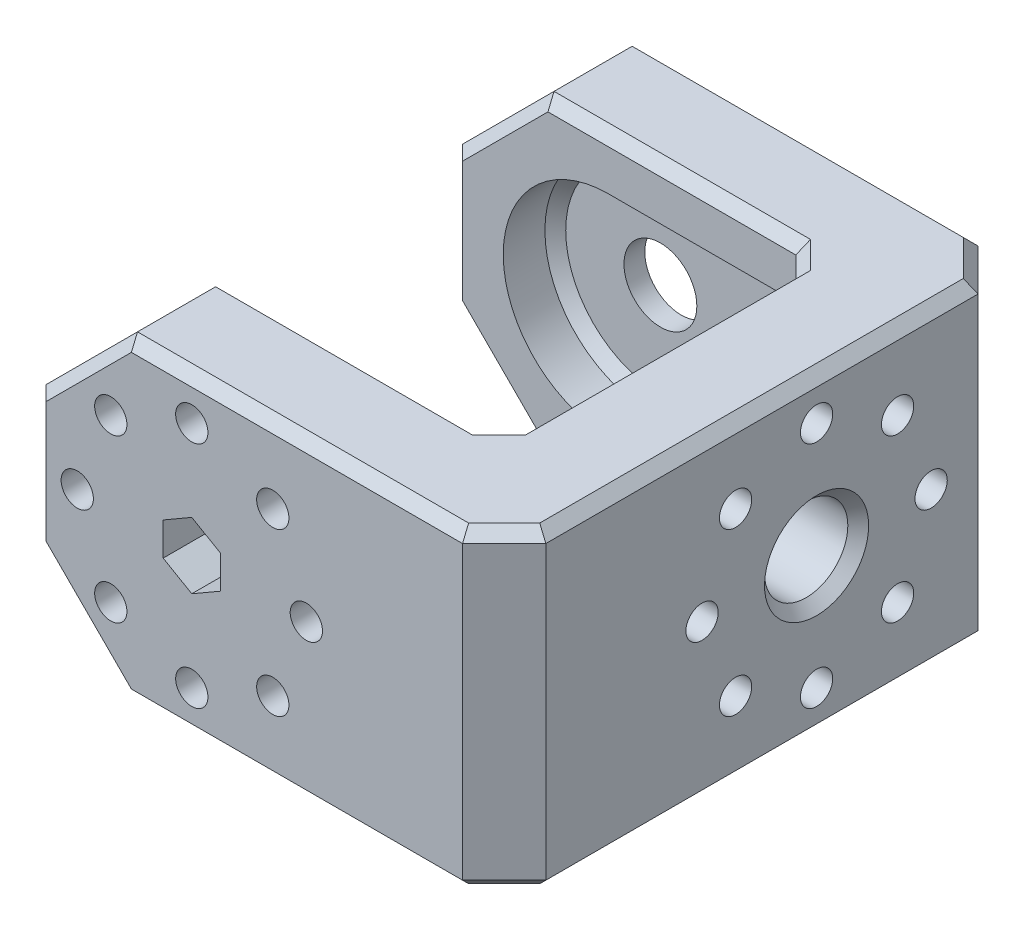
from build123d import *

# Parameters (mm, degrees)
SALIENTE_EXTRUIR1_DEPTH = 60
CROQUIS2_W              = 35
CROQUIS2_H              = 30.5
CROQUIS2_H_2            = 10.5
CORTAR_EXTRUIR1_DEPTH   = 74.484692283
CORTAR_EXTRUIR2_REACH   = 70.739
CROQUIS3_R              = 1.5
CORTAR_EXTRUIR3_DEPTH   = 5
CROQUIS5_R              = 4
CROQUIS5_R_2            = 1.55
CORTAR_EXTRUIR4_DEPTH   = 10
CORTAR_EXTRUIR5_DEPTH   = 5
CORTAR_EXTRUIR6_REACH   = 70.739
CROQUIS7_R              = 1.55
CORTAR_EXTRUIR7_DEPTH   = 5
CORTAR_EXTRUIR8_DEPTH   = 5
CORTAR_EXTRUIR9_REACH   = 61.793
CROQUIS10_R             = 3.5
CROQUIS11_R             = 8.22128135
CORTAR_EXTRUIR10_DEPTH  = 2.5
CROQUIS12_W             = 2.4
CROQUIS12_H             = 1.2
CORTAR_EXTRUIR11_DEPTH  = 3
CROQUIS13_W             = 10
CROQUIS13_H             = 10.5
CORTAR_EXTRUIR12_DEPTH  = 74.484692283
CHAFL_N5_SIZE           = 1
CHAFL_N4_SIZE           = 0.25
CHAFL_N1_SIZE           = 2
CHAFL_N2_SIZE           = 2
CHAFL_N6_SIZE           = 4
CHAFL_N7_SIZE           = 1
CHAFL_N3_SIZE           = 1


with BuildPart() as part:
    # Croquis1 → Saliente-Extruir1 (new body)
    with BuildSketch(Plane.XY):
        Polygon((6.213203436, 15), (30, 15), (30, -15), (6.213203436, -15), (-6.213203436, -15), (-15, -6.213203436), (-15, 6.213203436), (-6.213203436, 15), align=None)
    extrude(amount=SALIENTE_EXTRUIR1_DEPTH)

    # Croquis2 → Cortar-Extruir1 (cut, through all)
    with BuildSketch(Plane(origin=(0, 15, 0), x_dir=(1, 0, 0), z_dir=(0, 1, 0))):
        with Locations((2.5, -35.25)):
            Rectangle(CROQUIS2_W, CROQUIS2_H)
        with Locations((2.5, -5.25)):
            Rectangle(CROQUIS2_W, CROQUIS2_H_2)
    extrude(amount=-CORTAR_EXTRUIR1_DEPTH, mode=Mode.SUBTRACT)

    # Croquis3 → Cortar-Extruir2 (cut, up to next)
    with BuildSketch(Plane.XY.offset(60), mode=Mode.PRIVATE) as cortar_extruir2_sk1:
        Circle(CROQUIS3_R)
    cortar_extruir2_tool1 = extrude(cortar_extruir2_sk1.sketch, amount=-CORTAR_EXTRUIR2_REACH, mode=Mode.PRIVATE) & part.part
    add(cortar_extruir2_tool1.solids().sort_by_distance((0, 0, 60))[0], mode=Mode.SUBTRACT)

    # Croquis4 → Cortar-Extruir3 (cut)
    with BuildSketch(Plane.XY.offset(20)):
        with BuildLine():
            Line((0, 10.090227798), (20, 10.090227798))
            Line((20, 10.090227798), (20, -10.090227798))
            Line((20, -10.090227798), (0, -10.090227798))
            ThreePointArc((0, -10.090227798), (-10.090227798, 0), (0, 10.090227798))
        make_face()
    extrude(amount=-CORTAR_EXTRUIR3_DEPTH, mode=Mode.SUBTRACT)

    # Croquis5 → Cortar-Extruir4 (cut)
    with BuildSketch(Plane(origin=(30, 0, 0), x_dir=(0, 0, -1), z_dir=(1, 0, 0))):
        with Locations(Location((-30, 0, 0), (0, 0, 90))):
            Circle(CROQUIS5_R)
        with Locations(Location((-30, 11, 0), (0, 0, 90))):
            Circle(CROQUIS5_R_2)
        with Locations(Location((-22.221825407, 7.778174593, 0), (0, 0, 90))):
            Circle(CROQUIS5_R_2)
        with Locations(Location((-19, 0, 0), (0, 0, 90))):
            Circle(CROQUIS5_R_2)
        with Locations(Location((-22.221825407, -7.778174593, 0), (0, 0, 90))):
            Circle(CROQUIS5_R_2)
        with Locations(Location((-30, -11, 0), (0, 0, 90))):
            Circle(CROQUIS5_R_2)
        with Locations(Location((-37.778174593, -7.778174593, 0), (0, 0, 90))):
            Circle(CROQUIS5_R_2)
        with Locations(Location((-41, 0, 0), (0, 0, 90))):
            Circle(CROQUIS5_R_2)
        with Locations(Location((-37.778174593, 7.778174593, 0), (0, 0, 90))):
            Circle(CROQUIS5_R_2)
    extrude(amount=-CORTAR_EXTRUIR4_DEPTH, mode=Mode.SUBTRACT)

    # Croquis6 → Cortar-Extruir5 (cut)
    with BuildSketch(Plane.ZY.offset(-20)):
        Polygon((40.023540191, 5.532808996), (40.84540104, 8.600035443), (38.600035443, 10.84540104), (35.532808996, 10.023540191), (34.710948146, 6.956313744), (36.956313744, 4.710948146), align=None)
        Polygon((33.175426481, 11), (31.58771324, 13.75), (28.41228676, 13.75), (26.824573519, 11), (28.41228676, 8.25), (31.58771324, 8.25), align=None)
        Polygon((41, -3.175426481), (43.75, -1.58771324), (43.75, 1.58771324), (41, 3.175426481), (38.25, 1.58771324), (38.25, -1.58771324), align=None)
        Polygon((35.532808996, -10.023540191), (38.600035443, -10.84540104), (40.84540104, -8.600035443), (40.023540191, -5.532808996), (36.956313744, -4.710948146), (34.710948146, -6.956313744), align=None)
        Polygon((26.824573519, -11), (28.41228676, -13.75), (31.58771324, -13.75), (33.175426481, -11), (31.58771324, -8.25), (28.41228676, -8.25), align=None)
        Polygon((19.976459809, -5.532808996), (19.15459896, -8.600035443), (21.399964557, -10.84540104), (24.467191005, -10.023540191), (25.289051854, -6.956313744), (23.043686256, -4.710948146), align=None)
        Polygon((19, 3.175426481), (16.25, 1.58771324), (16.25, -1.58771324), (19, -3.175426481), (21.75, -1.58771324), (21.75, 1.58771324), align=None)
        Polygon((24.467191004, 10.023540191), (21.399964557, 10.84540104), (19.15459896, 8.600035443), (19.976459809, 5.532808996), (23.043686256, 4.710948146), (25.289051854, 6.956313744), align=None)
    extrude(amount=-CORTAR_EXTRUIR5_DEPTH, mode=Mode.SUBTRACT)

    # Croquis7 → Cortar-Extruir6 (cut, up to next)
    with BuildSketch(Plane.XY.offset(60), mode=Mode.PRIVATE) as cortar_extruir6_sk1:
        with Locations((0, 11)):
            Circle(CROQUIS7_R)
    cortar_extruir6_tool1 = extrude(cortar_extruir6_sk1.sketch, amount=-CORTAR_EXTRUIR6_REACH, mode=Mode.PRIVATE) & part.part
    # Croquis7 → Cortar-Extruir6 (cut, up to next)
    with BuildSketch(Plane.XY.offset(60), mode=Mode.PRIVATE) as cortar_extruir6_sk2:
        with Locations((7.778174593, 7.778174593)):
            Circle(CROQUIS7_R)
    cortar_extruir6_tool2 = extrude(cortar_extruir6_sk2.sketch, amount=-CORTAR_EXTRUIR6_REACH, mode=Mode.PRIVATE) & part.part
    # Croquis7 → Cortar-Extruir6 (cut, up to next)
    with BuildSketch(Plane.XY.offset(60), mode=Mode.PRIVATE) as cortar_extruir6_sk3:
        with Locations((11, 0)):
            Circle(CROQUIS7_R)
    cortar_extruir6_tool3 = extrude(cortar_extruir6_sk3.sketch, amount=-CORTAR_EXTRUIR6_REACH, mode=Mode.PRIVATE) & part.part
    # Croquis7 → Cortar-Extruir6 (cut, up to next)
    with BuildSketch(Plane.XY.offset(60), mode=Mode.PRIVATE) as cortar_extruir6_sk4:
        with Locations((7.778174593, -7.778174593)):
            Circle(CROQUIS7_R)
    cortar_extruir6_tool4 = extrude(cortar_extruir6_sk4.sketch, amount=-CORTAR_EXTRUIR6_REACH, mode=Mode.PRIVATE) & part.part
    # Croquis7 → Cortar-Extruir6 (cut, up to next)
    with BuildSketch(Plane.XY.offset(60), mode=Mode.PRIVATE) as cortar_extruir6_sk5:
        with Locations((0, -11)):
            Circle(CROQUIS7_R)
    cortar_extruir6_tool5 = extrude(cortar_extruir6_sk5.sketch, amount=-CORTAR_EXTRUIR6_REACH, mode=Mode.PRIVATE) & part.part
    # Croquis7 → Cortar-Extruir6 (cut, up to next)
    with BuildSketch(Plane.XY.offset(60), mode=Mode.PRIVATE) as cortar_extruir6_sk6:
        with Locations((-7.778174593, -7.778174593)):
            Circle(CROQUIS7_R)
    cortar_extruir6_tool6 = extrude(cortar_extruir6_sk6.sketch, amount=-CORTAR_EXTRUIR6_REACH, mode=Mode.PRIVATE) & part.part
    # Croquis7 → Cortar-Extruir6 (cut, up to next)
    with BuildSketch(Plane.XY.offset(60), mode=Mode.PRIVATE) as cortar_extruir6_sk7:
        with Locations((-11, 0)):
            Circle(CROQUIS7_R)
    cortar_extruir6_tool7 = extrude(cortar_extruir6_sk7.sketch, amount=-CORTAR_EXTRUIR6_REACH, mode=Mode.PRIVATE) & part.part
    # Croquis7 → Cortar-Extruir6 (cut, up to next)
    with BuildSketch(Plane.XY.offset(60), mode=Mode.PRIVATE) as cortar_extruir6_sk8:
        with Locations((-7.778174593, 7.778174593)):
            Circle(CROQUIS7_R)
    cortar_extruir6_tool8 = extrude(cortar_extruir6_sk8.sketch, amount=-CORTAR_EXTRUIR6_REACH, mode=Mode.PRIVATE) & part.part
    add(cortar_extruir6_tool1.solids().sort_by_distance((0, 11, 60))[0], mode=Mode.SUBTRACT)
    add(cortar_extruir6_tool2.solids().sort_by_distance((7.778175, 7.778175, 60))[0], mode=Mode.SUBTRACT)
    add(cortar_extruir6_tool3.solids().sort_by_distance((11, 0, 60))[0], mode=Mode.SUBTRACT)
    add(cortar_extruir6_tool4.solids().sort_by_distance((7.778175, -7.778175, 60))[0], mode=Mode.SUBTRACT)
    add(cortar_extruir6_tool5.solids().sort_by_distance((0, -11, 60))[0], mode=Mode.SUBTRACT)
    add(cortar_extruir6_tool6.solids().sort_by_distance((-7.778175, -7.778175, 60))[0], mode=Mode.SUBTRACT)
    add(cortar_extruir6_tool7.solids().sort_by_distance((-11, 0, 60))[0], mode=Mode.SUBTRACT)
    add(cortar_extruir6_tool8.solids().sort_by_distance((-7.778175, 7.778175, 60))[0], mode=Mode.SUBTRACT)

    # Croquis8 → Cortar-Extruir7 (cut)
    with BuildSketch(Plane(origin=(0, 0, 50.5), x_dir=(-1, 0, 0), z_dir=(0, 0, -1))):
        Polygon((6.956313744, 4.710948146), (10.023540191, 5.532808996), (10.84540104, 8.600035443), (8.600035443, 10.84540104), (5.532808996, 10.023540191), (4.710948146, 6.956313744), align=None)
        Polygon((3.175426481, 11), (1.58771324, 13.75), (-1.58771324, 13.75), (-3.175426481, 11), (-1.58771324, 8.25), (1.58771324, 8.25), align=None)
        Polygon((8.25, -1.58771324), (11, -3.175426481), (13.75, -1.58771324), (13.75, 1.58771324), (11, 3.175426481), (8.25, 1.58771324), align=None)
        Polygon((4.710948146, -6.956313744), (5.532808996, -10.023540191), (8.600035443, -10.84540104), (10.84540104, -8.600035443), (10.023540191, -5.532808995), (6.956313744, -4.710948146), align=None)
        Polygon((-1.58771324, -8.25), (-3.175426481, -11), (-1.58771324, -13.75), (1.58771324, -13.75), (3.175426481, -11), (1.58771324, -8.25), align=None)
        Polygon((-6.956313744, -4.710948146), (-10.023540191, -5.532808996), (-10.84540104, -8.600035443), (-8.600035443, -10.84540104), (-5.532808995, -10.023540191), (-4.710948146, -6.956313744), align=None)
        Polygon((-8.25, 1.58771324), (-11, 3.175426481), (-13.75, 1.58771324), (-13.75, -1.58771324), (-11, -3.175426481), (-8.25, -1.58771324), align=None)
        Polygon((-4.710948146, 6.956313744), (-5.532808996, 10.023540191), (-8.600035443, 10.84540104), (-10.84540104, 8.600035443), (-10.023540191, 5.532808995), (-6.956313744, 4.710948146), align=None)
    extrude(amount=-CORTAR_EXTRUIR7_DEPTH, mode=Mode.SUBTRACT)

    # Croquis9 → Cortar-Extruir8 (cut)
    with BuildSketch(Plane.XY.offset(60)):
        Polygon((0, 3.175426481), (-2.75, 1.58771324), (-2.75, -1.58771324), (0, -3.175426481), (2.75, -1.58771324), (2.75, 1.58771324), align=None)
    extrude(amount=-CORTAR_EXTRUIR8_DEPTH, mode=Mode.SUBTRACT)

    # Croquis10 → Cortar-Extruir9 (cut, up to next)
    with BuildSketch(Plane(origin=(0, 0, 10.5), x_dir=(-1, 0, 0), z_dir=(0, 0, -1)), mode=Mode.PRIVATE) as cortar_extruir9_sk1:
        Circle(CROQUIS10_R)
    cortar_extruir9_tool1 = extrude(cortar_extruir9_sk1.sketch, amount=-CORTAR_EXTRUIR9_REACH, mode=Mode.PRIVATE) & part.part
    add(cortar_extruir9_tool1.solids().sort_by_distance((0, 0, 10.5))[0], mode=Mode.SUBTRACT)

    # Croquis11 → Cortar-Extruir10 (cut)
    with BuildSketch(Plane(origin=(0, 0, 10.5), x_dir=(-1, 0, 0), z_dir=(0, 0, -1))):
        Circle(CROQUIS11_R)
    extrude(amount=-CORTAR_EXTRUIR10_DEPTH, mode=Mode.SUBTRACT)

    # Croquis12 → Cortar-Extruir11 (cut)
    with BuildSketch(Plane.XY.offset(15)):
        with Locations((0, 8)):
            Rectangle(CROQUIS12_W, CROQUIS12_H)
    extrude(amount=-CORTAR_EXTRUIR11_DEPTH, mode=Mode.SUBTRACT)

    # Croquis13 → Cortar-Extruir12 (cut, through all)
    with BuildSketch(Plane.XZ.offset(15)):
        with Locations((25, 5.25)):
            Rectangle(CROQUIS13_W, CROQUIS13_H)
    extrude(amount=-CORTAR_EXTRUIR12_DEPTH, mode=Mode.SUBTRACT)

    # Chaflán5
    chafl_n5_edges = [part.edges().sort_by_distance(p)[0] for p in [
        (20, -4, 30),
        (30, -4, 30),
    ]]
    chamfer(chafl_n5_edges, length=CHAFL_N5_SIZE)

    # Chaflán4
    chafl_n4_edges = [part.edges().sort_by_distance(p)[0] for p in [
        (1.2, 8, 15),
        (0, 8.6, 15),
        (-1.2, 8, 15),
        (0, 7.4, 15),
    ]]
    chamfer(chafl_n4_edges, length=CHAFL_N4_SIZE)

    # Chaflán1
    # the kernel refuses this chamfer: 2 mm, written as the material it adds along each edge
    with BuildSketch(Plane(origin=(20, 15, 50.5), x_dir=(0.027495876610585647, 0, -0.9996219169112968), z_dir=(0, -1, 0))) as chafl_n1_piece_1:
        Polygon((CHAFL_N1_SIZE * 0.999621916911, -CHAFL_N1_SIZE * 0.0274958766106), (-CHAFL_N1_SIZE * 0.0274958766106, -CHAFL_N1_SIZE * 0.999621916911), (0, 0), align=None)
    extrude(amount=30)
    with BuildSketch(Plane(origin=(20, -10.090227798, 20), x_dir=(0.027495876610585696, 0, 0.9996219169112968), z_dir=(0, -1, 0))) as chafl_n1_piece_2_section:
        Polygon((CHAFL_N1_SIZE * 0.999621916911, CHAFL_N1_SIZE * 0.0274958766106), (-CHAFL_N1_SIZE * 0.0274958766106, CHAFL_N1_SIZE * 0.999621916911), (0, 0), align=None)
    chafl_n1_piece_2 = extrude(amount=4.909772202, mode=Mode.PRIVATE)
    chafl_n1_piece_2 = split(chafl_n1_piece_2, bisect_by=Plane(origin=(19.221242509, -10.256505809, 20.811069327), z_dir=(0, -0.7071067811865422, -0.7071067811865529)), keep=Keep.TOP, mode=Mode.PRIVATE)
    add(chafl_n1_piece_2)
    with BuildSketch(Plane(origin=(20, -4.946861822, 20), x_dir=(0.027495876610585696, 0, 0.9996219169112968), z_dir=(0, -1, 0))) as chafl_n1_piece_3_section:
        Polygon((CHAFL_N1_SIZE * 0.999621916911, CHAFL_N1_SIZE * 0.0274958766106), (-CHAFL_N1_SIZE * 0.0274958766106, CHAFL_N1_SIZE * 0.999621916911), (0, 0), align=None)
    chafl_n1_piece_3 = extrude(amount=15.196504154, mode=Mode.PRIVATE)
    chafl_n1_piece_3 = split(chafl_n1_piece_3, bisect_by=Plane(origin=(19.849991139, -10.77775276, 21.652431375), z_dir=(0, -0.9659258262890706, 0.2588190451025121)), keep=Keep.TOP, mode=Mode.PRIVATE)
    chafl_n1_piece_3 = split(chafl_n1_piece_3, bisect_by=Plane(origin=(19.849991139, -11.050316955, 21.604880472), z_dir=(0, 0.7071067811865422, 0.7071067811865529)), keep=Keep.TOP, mode=Mode.PRIVATE)
    add(chafl_n1_piece_3)
    with BuildSketch(Plane(origin=(20, 15, 20), x_dir=(0.027495876610585696, 0, 0.9996219169112968), z_dir=(0, -1, 0))) as chafl_n1_piece_4_section:
        Polygon((CHAFL_N1_SIZE * 0.999621916911, CHAFL_N1_SIZE * 0.0274958766106), (-CHAFL_N1_SIZE * 0.0274958766106, CHAFL_N1_SIZE * 0.999621916911), (0, 0), align=None)
    chafl_n1_piece_4 = extrude(amount=10.053138178, mode=Mode.PRIVATE)
    chafl_n1_piece_4 = split(chafl_n1_piece_4, bisect_by=Plane(origin=(19.337901825, 11.172841883, 20.177938697), z_dir=(0, 0.9659258262890684, 0.2588190451025204)), keep=Keep.TOP, mode=Mode.PRIVATE)
    add(chafl_n1_piece_4)
    with BuildSketch(Plane(origin=(20, 20.143365976, 20), x_dir=(0.027495876610585696, 0, 0.9996219169112968), z_dir=(0, -1, 0))) as chafl_n1_piece_5_section:
        Polygon((CHAFL_N1_SIZE * 0.999621916911, CHAFL_N1_SIZE * 0.0274958766106), (-CHAFL_N1_SIZE * 0.0274958766106, CHAFL_N1_SIZE * 0.999621916911), (0, 0), align=None)
    chafl_n1_piece_5 = extrude(amount=10.053138178, mode=Mode.PRIVATE)
    chafl_n1_piece_5 = split(chafl_n1_piece_5, bisect_by=Plane(origin=(19.221242509, 10.256505809, 20.811069327), z_dir=(0, 0.7071067811865478, -0.7071067811865472)), keep=Keep.TOP, mode=Mode.PRIVATE)
    chafl_n1_piece_5 = split(chafl_n1_piece_5, bisect_by=Plane(origin=(19.221242509, 11.070012891, 20.561701717), z_dir=(0, -0.9659258262890684, -0.2588190451025204)), keep=Keep.TOP, mode=Mode.PRIVATE)
    add(chafl_n1_piece_5)

    # Chaflán2
    # the kernel refuses this chamfer: 2 mm, written as the material it adds along each edge
    with BuildSketch(Plane(origin=(20, 15.233593774, 15), x_dir=(-0.9996219169112968, 0, -0.02749587661058651), z_dir=(0, -1, 0))) as chafl_n2_piece_1_section:
        Polygon((CHAFL_N2_SIZE * 0.999621916911, -CHAFL_N2_SIZE * 0.0274958766106), (-CHAFL_N2_SIZE * 0.0274958766106, -CHAFL_N2_SIZE * 0.999621916911), (0, 0), align=None)
    chafl_n2_piece_1 = extrude(amount=25.323821571, mode=Mode.PRIVATE)
    chafl_n2_piece_1 = split(chafl_n2_piece_1, bisect_by=Plane(origin=(19.261226971, 5.628946063, 16.25), z_dir=(0, 0, -1)), keep=Keep.TOP, mode=Mode.PRIVATE)
    chafl_n2_piece_1 = split(chafl_n2_piece_1, bisect_by=Plane(origin=(19.261226971, 15, 15.522453942), z_dir=(0, -1, 0)), keep=Keep.TOP, mode=Mode.PRIVATE)
    add(chafl_n2_piece_1)
    with BuildSketch(Plane(origin=(20, 15.233593774, 15), x_dir=(-0.9996219169112968, 0, -0.02749587661058651), z_dir=(0, -1, 0))) as chafl_n2_piece_2_section:
        Polygon((CHAFL_N2_SIZE * 0.999621916911, -CHAFL_N2_SIZE * 0.0274958766106), (-CHAFL_N2_SIZE * 0.0274958766106, -CHAFL_N2_SIZE * 0.999621916911), (0, 0), align=None)
    chafl_n2_piece_2 = extrude(amount=30.467187547, mode=Mode.PRIVATE)
    chafl_n2_piece_2 = split(chafl_n2_piece_2, bisect_by=Plane(origin=(19.748920686, 2.775732432, 18.307709601), z_dir=(0, 0.8660254037844436, -0.4999999999999916)), keep=Keep.TOP, mode=Mode.PRIVATE)
    chafl_n2_piece_2 = split(chafl_n2_piece_2, bisect_by=Plane(origin=(19.748920686, 15, 16.497841372), z_dir=(0, -1, 0)), keep=Keep.TOP, mode=Mode.PRIVATE)
    add(chafl_n2_piece_2)
    with BuildSketch(Plane(origin=(20, 15.233593774, 15), x_dir=(-0.9996219169112968, 0, -0.02749587661058651), z_dir=(0, -1, 0))) as chafl_n2_piece_3_section:
        Polygon((CHAFL_N2_SIZE * 0.999621916911, -CHAFL_N2_SIZE * 0.0274958766106), (-CHAFL_N2_SIZE * 0.0274958766106, -CHAFL_N2_SIZE * 0.999621916911), (0, 0), align=None)
    chafl_n2_piece_3 = extrude(amount=25.323821571, mode=Mode.PRIVATE)
    chafl_n2_piece_3 = split(chafl_n2_piece_3, bisect_by=Plane(origin=(19.748920686, -2.775732432, 18.307709601), z_dir=(0, -0.8660254037844333, -0.5000000000000093)), keep=Keep.TOP, mode=Mode.PRIVATE)
    add(chafl_n2_piece_3)

    # Chaflán6
    chafl_n6_edges = [part.edges().sort_by_distance(p)[0] for p in [
        (30, 0, 10.5),
        (30, 0, 60),
    ]]
    chamfer(chafl_n6_edges, length=CHAFL_N6_SIZE)

    # Chaflán7
    chafl_n7_edges = [part.edges().sort_by_distance(p)[0] for p in [
        (9, 10.090227798, 15),
        (-10.090227798, 0, 15),
        (9, -10.090227798, 15),
    ]]
    chamfer(chafl_n7_edges, length=CHAFL_N7_SIZE)

    # Chaflán3
    chafl_n3_edges = [part.edges().sort_by_distance(p)[0] for p in [
        (-10.606601718, 10.606601718, 60),
        (-15, 0, 60),
        (-10.606601718, -10.606601718, 60),
        (5.893398282, -15, 50.5),
        (5.893398282, 15, 50.5),
        (-15, 0, 50.5),
        (-15, 0, 20),
        (-10.606601718, 10.606601718, 20),
        (-10.606601718, -10.606601718, 20),
        (9.893398282, -15, 60),
        (-10.606601718, 10.606601718, 50.5),
        (-10.606601718, -10.606601718, 50.5),
        (-10.606601718, 10.606601718, 10.5),
        (-10.606601718, -10.606601718, 10.5),
        (9.893398282, -15, 10.5),
        (-15, 0, 10.5),
        (9.893398282, 15, 10.5),
        (5.893398282, 15, 20),
        (5.893398282, -15, 20),
        (20, 15, 35.25),
        (20, -15, 35.25),
        (19, -15, 21),
        (19, 15, 21),
        (19, 15, 49.5),
        (19, -15, 49.5),
        (30, -15, 35.25),
        (28, -15, 58),
        (28, -15, 12.5),
        (30, 15, 35.25),
        (9.893398282, 15, 60),
        (28, 15, 58),
        (28, 15, 12.5),
    ]]
    chamfer(chafl_n3_edges, length=CHAFL_N3_SIZE)


solid = part.part
